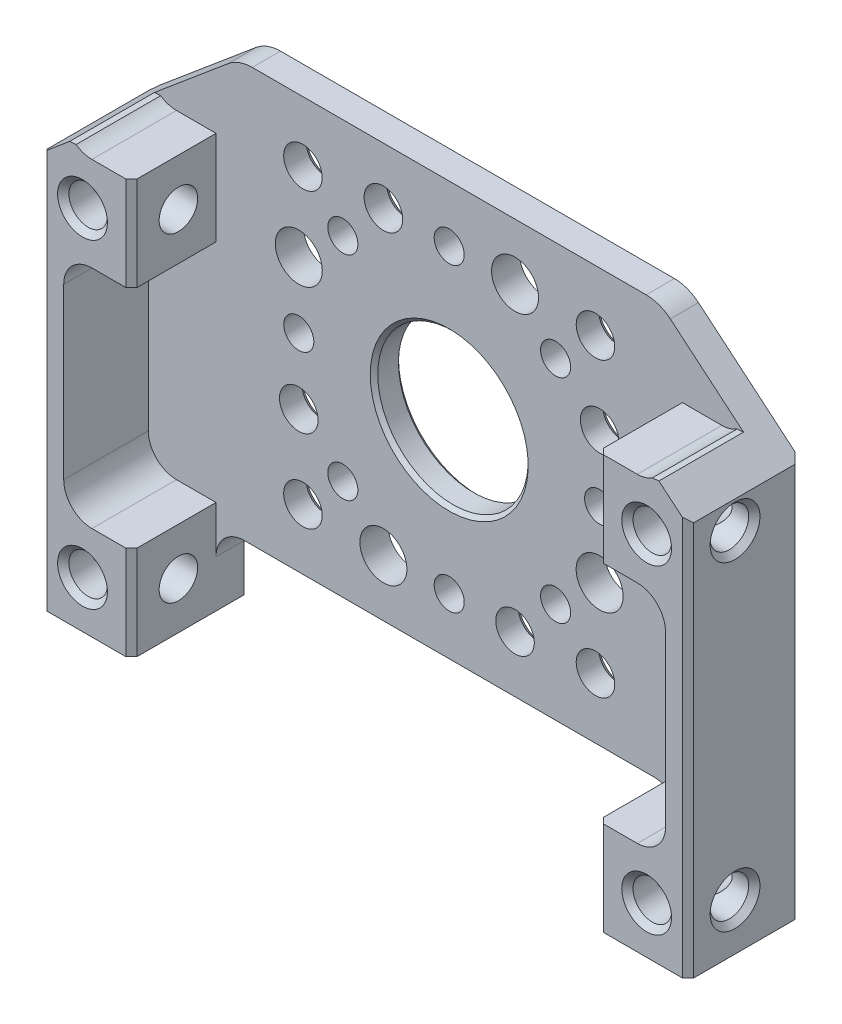
from build123d import *

# Parameters (mm, degrees)
BOSS_EXTRUDE1_DEPTH              = 4.5
BOSS_EXTRUDE2_DEPTH              = 1.5
SKETCH3_W                        = 34.4
SKETCH3_H                        = 6
BOSS_EXTRUDE3_DEPTH              = 16.965402213
SKETCH4_W                        = 4.5
SKETCH4_H                        = 18
CUT_EXTRUDE1_DEPTH               = 24.8
SKETCH5_W                        = 4.8
SKETCH5_H                        = 6
BOSS_EXTRUDE4_DEPTH              = 4
SKETCH6_W                        = 4.8
SKETCH6_H                        = 6
BOSS_EXTRUDE5_DEPTH              = 4
SKETCH7_W                        = 4.5
SKETCH7_H                        = 12
CUT_EXTRUDE2_DEPTH               = 3.6
SKETCH8_W                        = 3.6
SKETCH8_H                        = 12
CUT_EXTRUDE3_DEPTH               = 4.5
F_2_05_2_05_DIAMETER_HOLE1_D     = 2.05
F_2_05_2_05_DIAMETER_HOLE1_DEPTH = 4.8
F_2_05_2_05_DIAMETER_HOLE2_D     = 2.05
F_2_5_2_5_DIAMETER_HOLE1_D       = 2.5
F_2_05_2_05_DIAMETER_HOLE3_D     = 2.05
F_2_05_2_05_DIAMETER_HOLE3_DEPTH = 6.000025
F_1_6_1_6_DIAMETER_HOLE1_D       = 1.6
F_1_6_1_6_DIAMETER_HOLE1_DEPTH   = 6.000025
F_8_0_8_DIAMETER_HOLE1_D         = 8
F_2_05_2_05_DIAMETER_HOLE4_D     = 2.05
F_2_05_2_05_DIAMETER_HOLE4_DEPTH = 9.5
CHAMFER1_SIZE                    = 0.3
CHAMFER2_SIZE2                   = 0.199958733
CHAMFER2_SIZE                    = 0.19995667
CHAMFER3_SIZE                    = 0.18964074
CHAMFER3_SIZE_2                  = 0.224716875
FILLET1_R                        = 1.5
FILLET2_R                        = 2


with BuildPart() as part:
    # Sketch1 → Boss-Extrude1 (new body)
    with BuildSketch(Plane.XY.offset(-15)):
        with BuildLine():
            Line((-17.2, 5.965402213), (17.2, 5.965402213))
            Line((17.2, 5.965402213), (15.505698966, 7.387089586))
            ThreePointArc((15.505698966, 7.387089586), (15.038810903, 7.100113286), (14.5, 7))
            Line((14.5, 7), (-14.5, 7))
            ThreePointArc((-14.5, 7), (-15.038810903, 7.100113286), (-15.505698966, 7.387089586))
            Line((-15.505698966, 7.387089586), (-17.2, 5.965402213))
        make_face()
    extrude(amount=-BOSS_EXTRUDE1_DEPTH)

    # Sketch2 → Boss-Extrude2 (add)
    with BuildSketch(Plane(origin=(0, 0, -19.5), x_dir=(-1, 0, 0), z_dir=(0, 0, -1))):
        Polygon((17.2, 5.965402213), (-17.2, 5.965402213), (-11.2, 11), (11.2, 11), align=None)
    extrude(amount=BOSS_EXTRUDE2_DEPTH)

    # Sketch3 → Boss-Extrude3 (add)
    with BuildSketch(Plane.XZ.offset(-5.965402213)):
        with Locations((0, -18)):
            Rectangle(SKETCH3_W, SKETCH3_H)
    extrude(amount=BOSS_EXTRUDE3_DEPTH)

    # Sketch4 → Cut-Extrude1 (cut)
    with BuildSketch(Plane(origin=(12.4, 0, 0), x_dir=(0, 0, -1), z_dir=(1, 0, 0))):
        with Locations((17.25, -2)):
            Rectangle(SKETCH4_W, SKETCH4_H)
    extrude(amount=-CUT_EXTRUDE1_DEPTH, mode=Mode.SUBTRACT)

    # Sketch5 → Boss-Extrude4 (add)
    with BuildSketch(Plane.XZ.offset(11)):
        with Locations((14.8, -18)):
            Rectangle(SKETCH5_W, SKETCH5_H)
    extrude(amount=BOSS_EXTRUDE4_DEPTH)

    # Sketch6 → Boss-Extrude5 (add)
    with BuildSketch(Plane.XZ.offset(11)):
        with Locations((-14.8, -18)):
            Rectangle(SKETCH6_W, SKETCH6_H)
    extrude(amount=BOSS_EXTRUDE5_DEPTH)

    # Sketch7 → Cut-Extrude2 (cut)
    with BuildSketch(Plane(origin=(-12.4, 0, 0), x_dir=(0, 0, -1), z_dir=(1, 0, 0))):
        with Locations((17.25, -4)):
            Rectangle(SKETCH7_W, SKETCH7_H)
    extrude(amount=-CUT_EXTRUDE2_DEPTH, mode=Mode.SUBTRACT)

    # Sketch8 → Cut-Extrude3 (cut)
    with BuildSketch(Plane.XY.offset(-15)):
        with Locations((14.2, -4)):
            Rectangle(SKETCH8_W, SKETCH8_H)
    extrude(amount=-CUT_EXTRUDE3_DEPTH, mode=Mode.SUBTRACT)

    # Ø2.05 (2.05) Diameter Hole1
    with Locations(Plane(origin=(-12.4, 0, 0), x_dir=(0, 0, -1), z_dir=(1, 0, 0))):
        with Locations((17.5, 4.5), (17.5, -12.5)):
            Hole(F_2_05_2_05_DIAMETER_HOLE1_D / 2, depth=F_2_05_2_05_DIAMETER_HOLE1_DEPTH)

    # Ø2.05 (2.05) Diameter Hole2 (through all)
    with Locations(Plane.ZY.offset(-12.4)):
        with Locations((-17.5, 4.5), (-17.5, -12.5)):
            Hole(F_2_05_2_05_DIAMETER_HOLE2_D / 2)

    # Ø2.5 (2.5) Diameter Hole1 (through all)
    with Locations(Plane.XY.offset(-19.5)):
        with Locations((3.5, 8), (-8, 3.5), (-3.5, -8), (8, -3.5)):
            Hole(F_2_5_2_5_DIAMETER_HOLE1_D / 2)

    # Ø2.05 (2.05) Diameter Hole3
    with Locations(Plane(origin=(0, 0, -21), x_dir=(-1, 0, 0), z_dir=(0, 0, -1))):
        with Locations((3.5, 8), (8, -3.5), (-3.5, -8), (-8, 3.5), (7.778174593, 7.778174593), (7.778174593, -7.778174593), (-7.778174593, -7.778174593), (-7.778174593, 7.778174593)):
            Hole(F_2_05_2_05_DIAMETER_HOLE3_D / 2, depth=F_2_05_2_05_DIAMETER_HOLE3_DEPTH)

    # Ø1.6 (1.6) Diameter Hole1
    with Locations(Plane(origin=(0, 0, -21), x_dir=(-1, 0, 0), z_dir=(0, 0, -1))):
        with Locations((0, 8), (-5.656854249, 5.656854249), (-8, 0), (-5.656854249, -5.656854249), (0, -8), (5.656854249, -5.656854249), (8, 0), (5.656854249, 5.656854249)):
            Hole(F_1_6_1_6_DIAMETER_HOLE1_D / 2, depth=F_1_6_1_6_DIAMETER_HOLE1_DEPTH)

    # Ø8.0 (8) Diameter Hole1 (through all)
    with Locations(Plane.XY.offset(-19.5)):
        with Locations((0, 0)):
            Hole(F_8_0_8_DIAMETER_HOLE1_D / 2)

    # Ø2.05 (2.05) Diameter Hole4
    with Locations(Plane.XY.offset(-15)):
        with Locations((15, 4.5), (-15, 4.5), (15, -12.5), (-15, -12.5)):
            Hole(F_2_05_2_05_DIAMETER_HOLE4_D / 2, depth=F_2_05_2_05_DIAMETER_HOLE4_DEPTH)

    # Chamfer1
    chamfer1_edges = [part.edges().sort_by_distance(p)[0] for p in [
        (12.4, -12.5, -15),
        (17.2, -12.5, -16.475),
        (17.2, 4.5, -16.475),
        (6.753174593, 7.778174593, -21),
        (6.753174593, -7.778174593, -21),
        (-8.803174593, -7.778174593, -21),
        (-8.803174593, 7.778174593, -21),
        (6.975, 3.5, -21),
        (2.475, -8, -21),
        (-9.025, -3.5, -21),
        (-4.525, 8, -21),
        (-6.456854249, 5.656854249, -21),
        (-8.8, 0, -21),
        (-6.456854249, -5.656854249, -21),
        (-0.8, -8, -21),
        (4.856854249, -5.656854249, -21),
        (7.2, 0, -21),
        (4.856854249, 5.656854249, -21),
        (-0.8, 8, -21),
        (-13.975, -12.5, -15),
        (16.025, -12.5, -15),
        (-13.975, 4.5, -15),
        (16.025, 4.5, -15),
        (17.2, -4.517298894, -15),
        (-17.2, -4.517298894, -15),
        (-17.2, -4.517298894, -21),
        (17.2, -4.517298894, -21),
        (-12.4, 4.5, -15),
        (12.4, 4.5, -15),
        (-12.4, -12.5, -15),
    ]]
    chamfer(chamfer1_edges, length=CHAMFER1_SIZE)

    # Chamfer2
    chamfer2_edges = [part.edges().sort_by_distance(p)[0] for p in [
        (4, 0, -21),
        (4, 0, -19.5),
    ]]
    chamfer(chamfer2_edges, length=CHAMFER2_SIZE, length2=CHAMFER2_SIZE2)

    # Chamfer3
    # the kernel refuses this chamfer: 0.224716875, 0.18964074 mm, written as the material it takes off along each edge
    with BuildSketch(Plane(origin=(15.505698966, 7.387089586, -14.344718434), x_dir=(0.7660444431190041, -0.6427876096865084, 0), z_dir=(0, 0, -1))) as chamfer3_piece_1:
        with BuildLine():
            Line((CHAMFER3_SIZE * 1.00000000217, 0), (-0.056208561, 0.248157995))
            ThreePointArc((-0.056208561, 0.248157995), (-0.023684334, 0.129009753), (0, 0))
            Line((0, 0), (CHAMFER3_SIZE * 1.00000000217, 0))
        make_face()
    extrude(amount=5.155281566, mode=Mode.SUBTRACT)
    with BuildSketch(Plane(origin=(-15.505698966, 7.387089586, -14.420065816), x_dir=(-0.7660444431188352, -0.6427876096867096, 0), z_dir=(0, 0, -1))) as chamfer3_piece_2:
        with BuildLine():
            Line((CHAMFER3_SIZE_2 * 0.999999998201, 0), (-0.041658025, -0.199529783))
            ThreePointArc((-0.041658025, -0.199529783), (-0.018131885, -0.103788276), (0, 0))
            Line((0, 0), (CHAMFER3_SIZE_2 * 0.999999998201, 0))
        make_face()
    extrude(amount=5.079934184, mode=Mode.SUBTRACT)

    # Fillet1
    fillet1_edges = [part.edges().sort_by_distance(p)[0] for p in [
        (16, 2, -17.25),
        (-16, -10, -17.25),
        (-16, 2, -17.25),
        (12.4, -11, -20.25),
        (16, -10, -17.25),
        (-12.4, -11, -20.25),
    ]]
    fillet(fillet1_edges, radius=FILLET1_R)

    # Fillet2
    fillet2_edges = [part.edges().sort_by_distance(p)[0] for p in [
        (11.2, 11, -20.25),
        (-11.2, 11, -20.25),
    ]]
    fillet(fillet2_edges, radius=FILLET2_R)


solid = part.part
